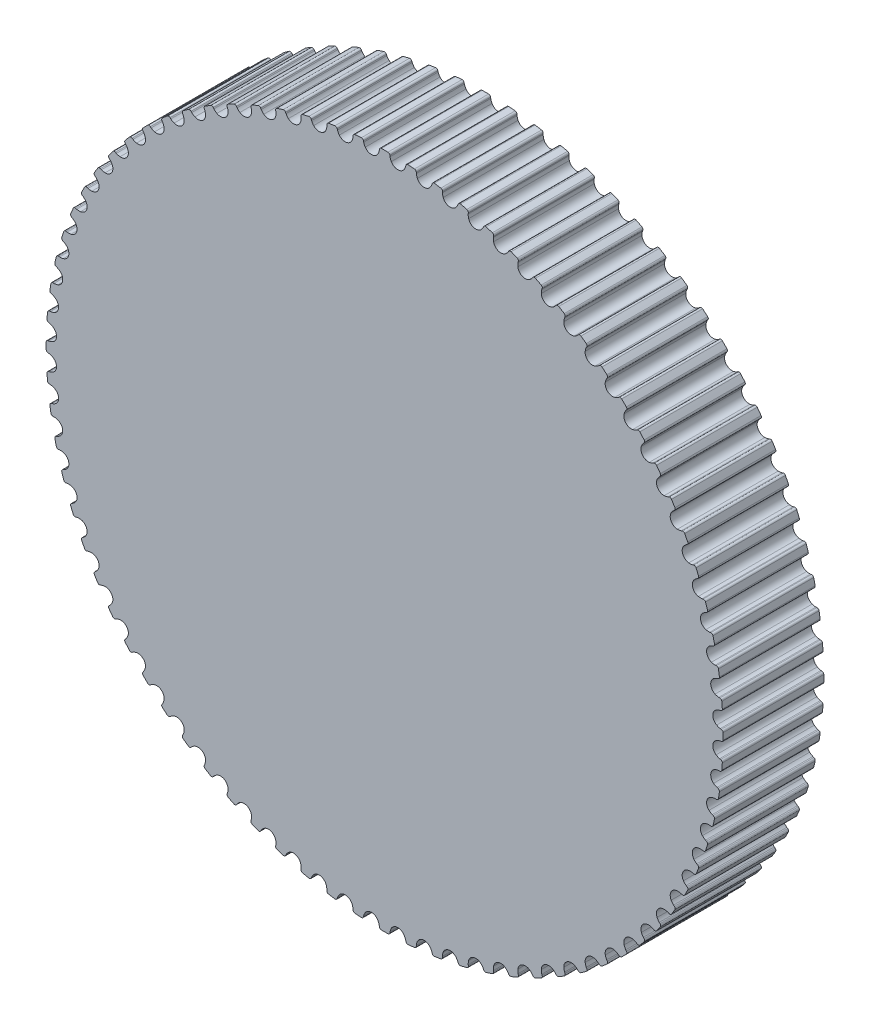
from build123d import *

# Parameters (mm, degrees)
BOSS_EXTRUDE1_DEPTH = 7.5
CIRPATTERN1_COUNT   = 80
SKETCH2_R           = 24.460790895
BOSS_EXTRUDE2_DEPTH = 7.5


with BuildPart() as part:
    # Sketch1 → Boss-Extrude1 (new body)
    with BuildSketch(Plane.XY):
        with BuildLine():
            ThreePointArc((0.960326144, 24.441932511), (0.691289336, 24.523804685), (0.49692063, 24.727040172))
            ThreePointArc((0.49692063, 24.727040172), (0.437816179, 24.857807873), (0.400982252, 24.996504627))
            ThreePointArc((0.400982252, 24.996504627), (0.394816763, 25.035336534), (0.390182551, 25.074380795))
            ThreePointArc((0.390182551, 25.074380795), (0.342159415, 25.1703055), (0.242351258, 25.209626007))
            ThreePointArc((0.242351258, 25.209626007), (0, 25.210790895), (-0.242351258, 25.209626007))
            ThreePointArc((-0.242351258, 25.209626007), (-0.342159415, 25.1703055), (-0.390182551, 25.074380795))
            ThreePointArc((-0.390182551, 25.074380795), (-0.394816763, 25.035336534), (-0.400982252, 24.996504627))
            ThreePointArc((-0.400982252, 24.996504627), (-0.437816179, 24.857807873), (-0.49692063, 24.727040172))
            ThreePointArc((-0.49692063, 24.727040172), (-0.691289336, 24.523804685), (-0.960326144, 24.441932511))
            ThreePointArc((-0.960326144, 24.441932511), (0, 24.460790895), (0.960326144, 24.441932511))
        make_face()
    extrude(amount=BOSS_EXTRUDE1_DEPTH)

    # CirPattern1: part ×80 about axis
    cirpattern1_axis = Axis((0, 0, 0), (0, 0, 1))


with BuildPart() as part_1:
    add(part.part)
    for i in range(1, CIRPATTERN1_COUNT):
        add(part.part.rotate(cirpattern1_axis, i * 360 / CIRPATTERN1_COUNT))

    # Sketch2 → Boss-Extrude2 (add)
    with BuildSketch(Plane(origin=(0, 0, 0), x_dir=(-1, 0, 0), z_dir=(0, 0, -1))):
        Circle(SKETCH2_R)
    extrude(amount=-BOSS_EXTRUDE2_DEPTH)


solid = part_1.part
